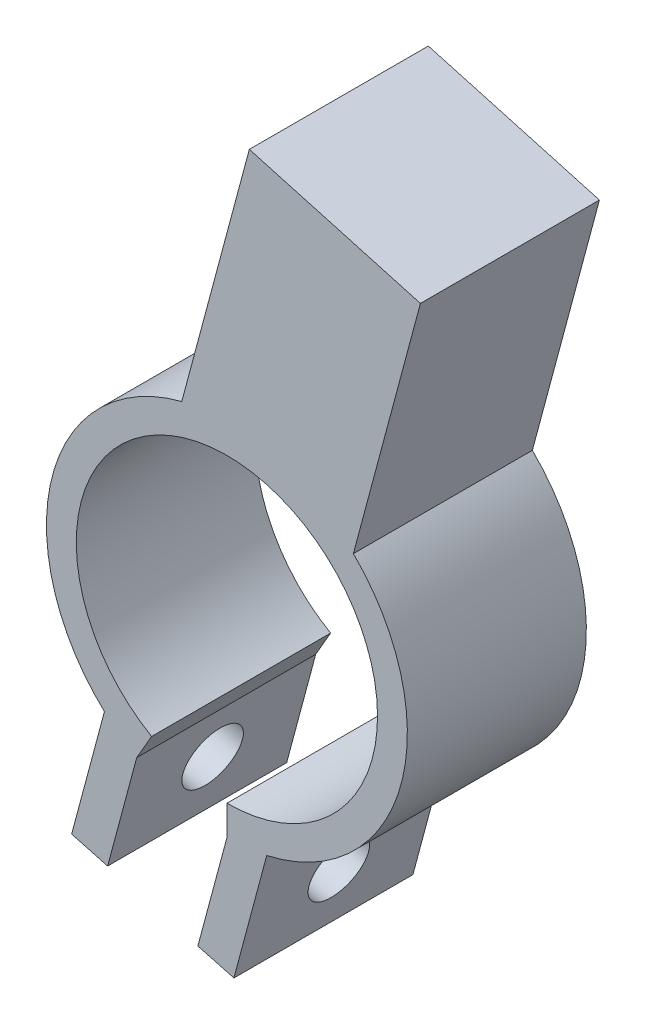
from build123d import *

# Parameters (mm, degrees)
SKETCH1_R           = 24.193
SKETCH1_R_2         = 20.193
BOSS_EXTRUDE1_DEPTH = 24
CUT_EXTRUDE1_DEPTH  = 24
BOSS_EXTRUDE2_START = -24
BOSS_EXTRUDE2_DEPTH = 24
CUT_EXTRUDE2_DEPTH  = 24
BOSS_EXTRUDE4_START = -24
BOSS_EXTRUDE4_DEPTH = 24


with BuildPart() as part:
    # Sketch1 → Boss-Extrude1 (new body)
    with BuildSketch(Plane.XY):
        Circle(SKETCH1_R)
        Circle(SKETCH1_R_2, mode=Mode.SUBTRACT)
    extrude(amount=BOSS_EXTRUDE1_DEPTH)

    # Sketch2 → Cut-Extrude1 (cut)
    with BuildSketch(Plane.XY.offset(24)):
        Polygon((0, -24.193), (-5.8341998, -24.895299835), (-12.0965, -20.951752594), (0, 0), align=None)
    extrude(amount=-CUT_EXTRUDE1_DEPTH, mode=Mode.SUBTRACT)

    # Sketch3 → Boss-Extrude2 (add)
    with BuildSketch(Plane.XY.offset(24).offset(BOSS_EXTRUDE2_START)):
        with BuildLine():
            Line((-15.990029306, -35.482601784), (-12.0965, -20.951752594))
            ThreePointArc((-12.0965, -20.951752594), (-14.346719144, -19.480064138), (-16.419734671, -17.767767512))
            Line((-16.419734671, -17.767767512), (-20.819658437, -34.188506559))
            Line((-20.819658437, -34.188506559), (-15.990029306, -35.482601784))
        make_face()
        with BuildLine():
            ThreePointArc((5.336023592, -23.597205369), (2.684591171, -24.043589982), (0, -24.193))
            Line((0, -24.193), (-3.893529306, -38.72384919))
            Line((-3.893529306, -38.72384919), (0.936099826, -40.017944416))
            Line((0.936099826, -40.017944416), (5.336023592, -23.597205369))
        make_face()
    extrude(amount=BOSS_EXTRUDE2_DEPTH)

    # Sketch4 → Cut-Extrude2 (cut)
    with BuildSketch(Plane(origin=(-10.877879131, 2.914718929, 0), x_dir=(0, 0, 1), z_dir=(-0.9659258262890682, 0.2588190451025212, 0))):
        with BuildLine():
            ThreePointArc((12, -34.412085563), (14.828427125, -33.240512688), (16, -30.412085563))
            ThreePointArc((16, -30.412085563), (9.171572875, -27.583658439), (12, -34.412085563))
        make_face()
    extrude(amount=-CUT_EXTRUDE2_DEPTH, mode=Mode.SUBTRACT)

    # Sketch5 → Boss-Extrude4 (add)
    with BuildSketch(Plane.XY.offset(24).offset(BOSS_EXTRUDE4_START)):
        with BuildLine():
            ThreePointArc((-6.052435886, 23.423690334), (6.261609158, 23.368643515), (16.953408399, 17.259292937))
            Line((16.953408399, 17.259292937), (25.944897535, 50.81598723))
            Line((25.944897535, 50.81598723), (3.006230693, 57.231094254))
            Line((3.006230693, 57.231094254), (-6.052435886, 23.423690334))
        make_face()
    extrude(amount=BOSS_EXTRUDE4_DEPTH)


solid = part.part
